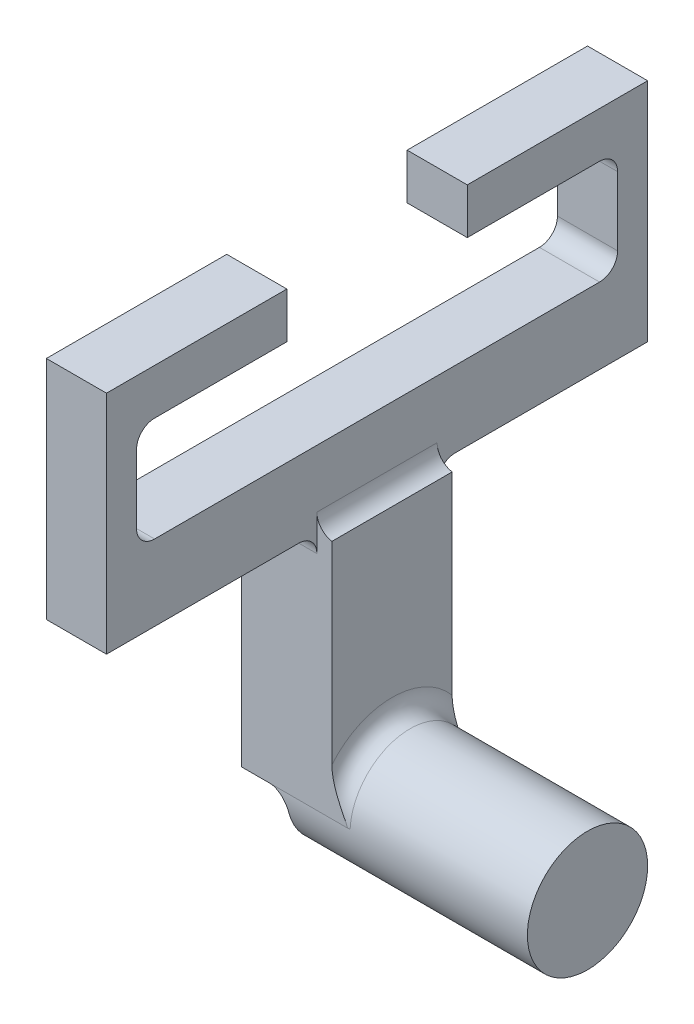
from build123d import *

# Parameters (mm, degrees)
SKETCH2_R           = 12.7
BOSS_EXTRUDE1_DEPTH = 50.8
SKETCH3_W           = 25.4
SKETCH3_H           = 50.8
BOSS_EXTRUDE2_DEPTH = 9.525
SKETCH5_W           = 101.6
SKETCH5_H           = 16.002
BOSS_EXTRUDE3_DEPTH = 6.35
SKETCH6_W           = 6.35
SKETCH6_H           = 38.1
BOSS_EXTRUDE4_DEPTH = 6.35
SKETCH7_W           = 38.1
SKETCH7_H           = 9.652
BOSS_EXTRUDE5_DEPTH = 6.35
FILLET1_R           = 3.81
FILLET2_R           = 3.81


with BuildPart() as part:
    # Sketch2 → Boss-Extrude1 (new body)
    with BuildSketch(Plane(origin=(0, 0, 0), x_dir=(0, 0, -1), z_dir=(1, 0, 0))):
        Circle(SKETCH2_R)
    extrude(amount=BOSS_EXTRUDE1_DEPTH)

    # Sketch3 → Boss-Extrude2 (add, symmetric)
    with BuildSketch(Plane.ZY):
        with Locations((0.014597196, 26.008732875)):
            Rectangle(SKETCH3_W, SKETCH3_H)
    extrude(amount=BOSS_EXTRUDE2_DEPTH, both=True)


with BuildPart() as body_2:
    # Sketch5 → Boss-Extrude3 (new, symmetric)
    with BuildSketch(Plane(origin=(0, 0, 0), x_dir=(0, 0, -1), z_dir=(1, 0, 0))):
        with Locations((0, 59.392294155)):
            Rectangle(SKETCH5_W, SKETCH5_H)
    extrude(amount=BOSS_EXTRUDE3_DEPTH, both=True)

    # Sketch6 → Boss-Extrude4 (add, symmetric)
    with BuildSketch(Plane(origin=(0, 0, 0), x_dir=(0, 0, -1), z_dir=(1, 0, 0))):
        with Locations((-53.975, 70.441294155)):
            Rectangle(SKETCH6_W, SKETCH6_H)
        with Locations((53.975, 70.441294155)):
            Rectangle(SKETCH6_W, SKETCH6_H)
    extrude(amount=BOSS_EXTRUDE4_DEPTH, both=True)

    # Sketch7 → Boss-Extrude5 (add, symmetric)
    with BuildSketch(Plane(origin=(0, 0, 0), x_dir=(0, 0, -1), z_dir=(1, 0, 0))):
        with Locations((-38.1, 94.317294155)):
            Rectangle(SKETCH7_W, SKETCH7_H)
        with Locations((38.1, 94.317294155)):
            Rectangle(SKETCH7_W, SKETCH7_H)
    extrude(amount=BOSS_EXTRUDE5_DEPTH, both=True)


with BuildPart() as part_1:
    add(part.part)

    # Combine1: union body 2
    add(body_2.part)

    # Fillet1
    # the kernel refuses this fillet: 3.81 mm, written as the material it adds along each edge
    with BuildSketch(Plane(origin=(-6.35, 51.391294155, 12.714597196), x_dir=(0, -1, 0), z_dir=(1, 0, 0)), Plane(origin=(6.35, 51.391294155, -12.685402804), x_dir=(0, -1, 0), z_dir=(-1, 0, 0)), Plane(origin=(6.35, 67.393294155, -50.8), x_dir=(0, 1, 0), z_dir=(-1, 0, 0)), Plane(origin=(-6.35, 89.491294155, 50.8), x_dir=(0, 0, -1), z_dir=(1, 0, 0)), Plane(origin=(-6.35, 67.393294155, 50.8), x_dir=(0, 1, 0), z_dir=(1, 0, 0))) as fillet1_piece_1:
        with BuildLine():
            CenterArc((FILLET1_R, -FILLET1_R), FILLET1_R, 90, 90)
            Line((0, -FILLET1_R), (0, 0))
            Line((0, 0), (FILLET1_R, 0))
        make_face()
    extrude(amount=12.7)
    with BuildSketch(Plane(origin=(9.525, 0, 0), x_dir=(0, -0.6466492608489325, 0.762787475935158), z_dir=(0, -0.762787475935158, -0.6466492608489325))) as fillet1_piece_2_section:
        with BuildLine():
            CenterArc((12.7 + FILLET1_R, -FILLET1_R), FILLET1_R, 90, 90)
            Line((12.7 + FILLET1_R, 0), (12.7, 0))
            Line((12.7, 0), (12.7, -FILLET1_R))
        make_face()
    fillet1_piece_2 = revolve(axis=Axis((9.525, 0, 0), (-1, 0, 0)), revolution_arc=260.578888602, mode=Mode.PRIVATE)
    fillet1_piece_2 = split(fillet1_piece_2, bisect_by=Plane(origin=(10.607555303, 13.782555283, -12.685402804), z_dir=(0, 0, 1)), keep=Keep.TOP, mode=Mode.PRIVATE)
    fillet1_piece_2 = split(fillet1_piece_2, bisect_by=Plane(origin=(10.607555303, 0.608732875, 0.000757571), z_dir=(0, 1, 0)), keep=Keep.TOP, mode=Mode.PRIVATE)
    fillet1_piece_2 = split(fillet1_piece_2, bisect_by=Plane(origin=(10.607555303, 13.782555283, 12.714597196), z_dir=(0, 0, -1)), keep=Keep.TOP, mode=Mode.PRIVATE)
    add(fillet1_piece_2)
    with BuildSketch(Plane(origin=(6.35, 89.491294155, -50.8), x_dir=(0, -1, 0), z_dir=(-1, 0, 0))) as fillet1_piece_3:
        with BuildLine():
            CenterArc((FILLET1_R, FILLET1_R), FILLET1_R, 180, 90)
            Line((0, FILLET1_R), (0, 0))
            Line((0, 0), (FILLET1_R, 0))
        make_face()
    extrude(amount=12.7)

    # Fillet2
    # the kernel refuses this fillet: 3.81 mm, written as the material it adds along each edge
    with BuildSketch(Plane(origin=(0, 0.608732875, 22.210402804), x_dir=(-1, 0, 0), z_dir=(0, 0, -1))) as fillet2_piece_1_section:
        with BuildLine():
            CenterArc((FILLET2_R, -FILLET2_R), FILLET2_R, 90, 90)
            Line((0, -FILLET2_R), (0, 0))
            Line((0, 0), (FILLET2_R, 0))
        make_face()
    fillet2_piece_1 = extrude(amount=44.420805607, mode=Mode.PRIVATE)
    fillet2_piece_1 = fillet2_piece_1 & Plane(origin=(-0.851863451, 0, 0), x_dir=(0, 0, -1), z_dir=(-1, 0, 0)) * Cylinder(12.7, 105, mode=Mode.PRIVATE)
    add(fillet2_piece_1)
    with BuildSketch(Plane(origin=(-6.35, 51.408732875, 12.714597196), x_dir=(0, 1, 0), z_dir=(0, 0, -1))) as fillet2_piece_2:
        with BuildLine():
            CenterArc((3.756710662, -3.81), FILLET2_R, 90, 80.405931773)
            Line((0, -3.175), (0, 0))
            Line((0, 0), (3.756710662, 0))
        make_face()
    extrude(amount=25.4)
    with BuildSketch(Plane(origin=(6.35, 51.408732875, 12.714597196), x_dir=(0, 1, 0), z_dir=(0, 0, -1))) as fillet2_piece_3:
        with BuildLine():
            CenterArc((3.756710662, 3.81), FILLET2_R, 189.594068227, 80.405931773)
            Line((0, 3.175), (0, 0))
            Line((0, 0), (3.756710662, 0))
        make_face()
    extrude(amount=25.4)


solid = part_1.part
